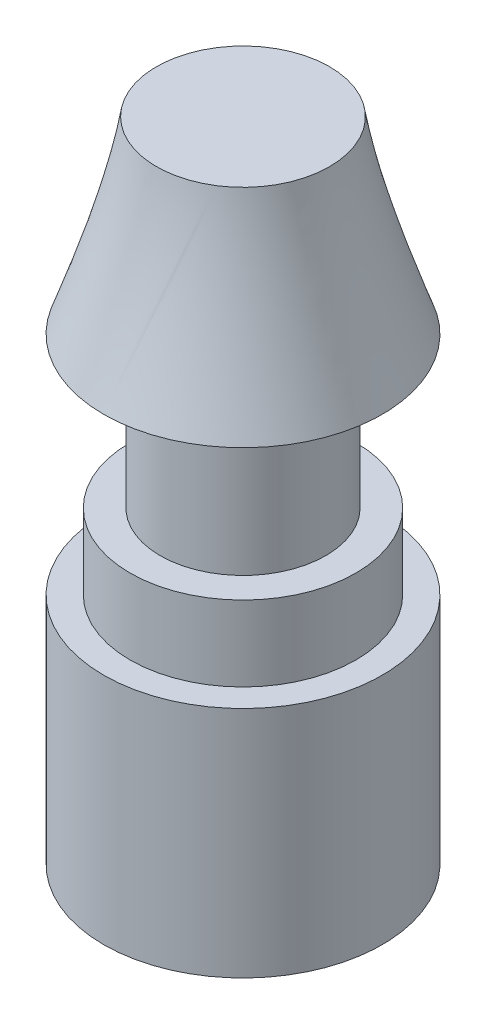
from build123d import *

# Parameters (mm, degrees)
SKETCH1_R           = 1.85
BOSS_EXTRUDE1_DEPTH = 3.1
SKETCH2_R           = 1.5
BOSS_EXTRUDE2_DEPTH = 1
SKETCH3_R           = 1.1
BOSS_EXTRUDE3_DEPTH = 2


with BuildPart() as part:
    # Sketch1 → Boss-Extrude1 (new body)
    with BuildSketch(Plane(origin=(0, 0, 0), x_dir=(1, 0, 0), z_dir=(0, 1, 0))):
        with Locations(Location((0, 0, 0), (0, 0, 90))):
            Circle(SKETCH1_R)
    extrude(amount=BOSS_EXTRUDE1_DEPTH)

    # Sketch2 → Boss-Extrude2 (add)
    with BuildSketch(Plane(origin=(0, 3.1, 0), x_dir=(1, 0, 0), z_dir=(0, 1, 0))):
        with Locations(Location((0, 0, 0), (0, 0, 270))):
            Circle(SKETCH2_R)
    extrude(amount=BOSS_EXTRUDE2_DEPTH)

    # Sketch3 → Boss-Extrude3 (add)
    with BuildSketch(Plane(origin=(0, 4.1, 0), x_dir=(1, 0, 0), z_dir=(0, 1, 0))):
        with Locations(Location((0, 0, 0), (0, 0, 270))):
            Circle(SKETCH3_R)
    extrude(amount=BOSS_EXTRUDE3_DEPTH)

    # Loft1: read off the stored shape, not the designer's step
    # Loft1: loft between two sections, ruled curve by curve
    loft1_from = [
        Edge.make_bspline([(0, 6.1, 1.85), (3.7, 6.1, 1.85), (3.7, 6.1, -1.85), (0, 6.1, -1.85), (-3.7, 6.1, -1.85), (-3.7, 6.1, 1.85), (0, 6.1, 1.85)], [0, 0, 0, 0, 0.5, 0.5, 0.5, 1, 1, 1, 1], 3, [1, 0.333333333, 0.333333333, 1, 0.333333333, 0.333333333, 1]),
    ]
    loft1_to = [
        Edge.make_bspline([(0.620465421, 8.6, 0.968257539), (2.556980499, 8.6, -0.272673303), (1.316049657, 8.6, -2.209188381), (-0.620465421, 8.6, -0.968257539), (-2.556980499, 8.6, 0.272673303), (-1.316049657, 8.6, 2.209188381), (0.620465421, 8.6, 0.968257539)], [0, 0, 0, 0, 0.5, 0.5, 0.5, 1, 1, 1, 1], 3, [1, 0.333333333, 0.333333333, 1, 0.333333333, 0.333333333, 1]),
    ]
    loft1 = Solid(Shell([*[Face.make_surface_from_curves(loft1_from[k], loft1_to[k]) for k in range(1)], Face(Wire(loft1_from)), Face(Wire(loft1_to))]))
    add(loft1)


solid = part.part
